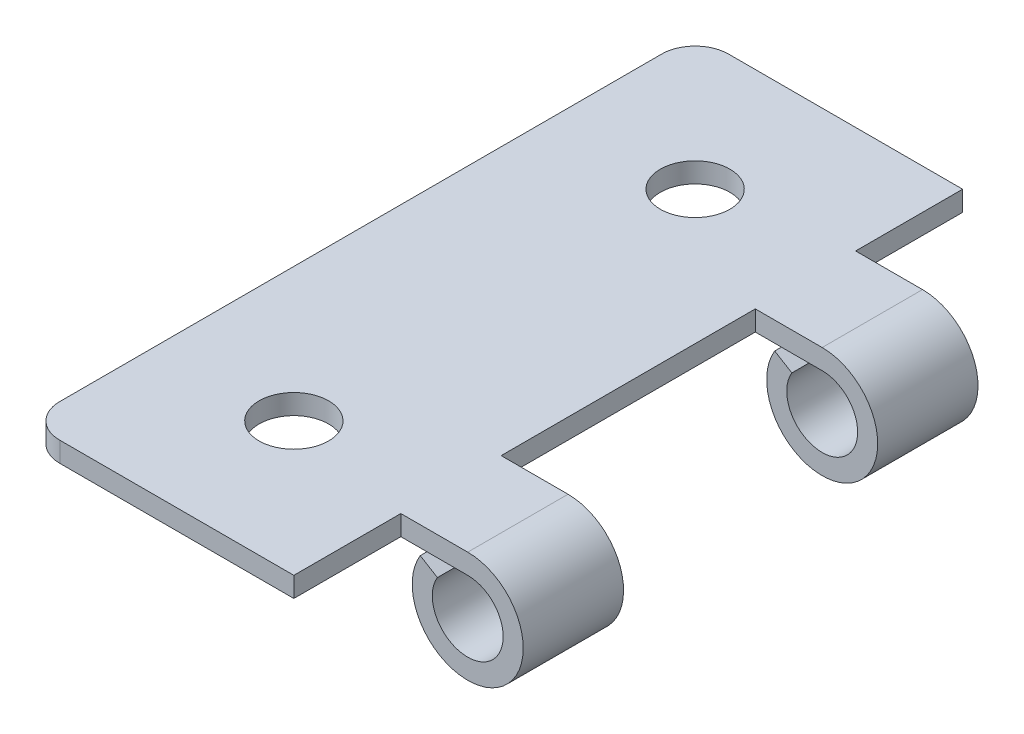
from build123d import *

# Parameters (mm, degrees)
TABAN_FLAN_1_DEPTH    = 25
IZIM9_W               = 9.15
IZIM9_H               = 8
IZIM9_H_2             = 19
KES_EKSTR_ZYON1_DEPTH = 32.162677998
IZIM11_R              = 2.6
KES_EKSTR_ZYON2_DEPTH = 10
RADYUS1_R             = 2.5


# Sheet-metal steps are written as plain solids
with BuildPart() as part:
    # Çizim1 → Taban-Flanş1 (new, symmetric)
    with BuildSketch(Plane.XY):
        with BuildLine():
            Line((-12.5, 0), (12.5, 0))
            ThreePointArc((12.5, 0), (14.537154879, -7.765591238), (8.95035213, -2))
            Line((8.95035213, -2), (10.233357384, -2.777108434))
            ThreePointArc((10.233357384, -2.777108434), (13.800833838, -6.458751031), (12.5, -1.5))
            Line((12.5, -1.5), (-12.5, -1.5))
            Line((-12.5, -1.5), (-12.5, 0))
        make_face()
    extrude(amount=TABAN_FLAN_1_DEPTH, both=True)

    # Çizim9 → Kes-Ekstrüzyon1 (cut, through all)
    with BuildSketch(Plane(origin=(0, 0, 0), x_dir=(1, 0, 0), z_dir=(0, 1, 0))):
        with Locations((12.075, 21)):
            Rectangle(IZIM9_W, IZIM9_H)
        with Locations((12.075, -21)):
            Rectangle(IZIM9_W, IZIM9_H)
        with Locations((12.075, 0)):
            Rectangle(IZIM9_W, IZIM9_H_2)
    extrude(amount=-KES_EKSTR_ZYON1_DEPTH, mode=Mode.SUBTRACT)

    # Çizim11 → Kes-Ekstrüzyon2 (cut)
    with BuildSketch(Plane(origin=(0, 0, 0), x_dir=(1, 0, 0), z_dir=(0, 1, 0))):
        with Locations(Location((-2.5, 15, 0), (0, 0, 180))):
            Circle(IZIM11_R)
        with Locations(Location((-2.5, -15, 0), (0, 0, 180))):
            Circle(IZIM11_R)
    extrude(amount=-KES_EKSTR_ZYON2_DEPTH, mode=Mode.SUBTRACT)

    # Radyus1
    radyus1_edges = [part.edges().sort_by_distance(p)[0] for p in [
        (-12.5, -0.75, 25),
        (-12.5, -0.75, -25),
    ]]
    fillet(radyus1_edges, radius=RADYUS1_R)


solid = part.part
